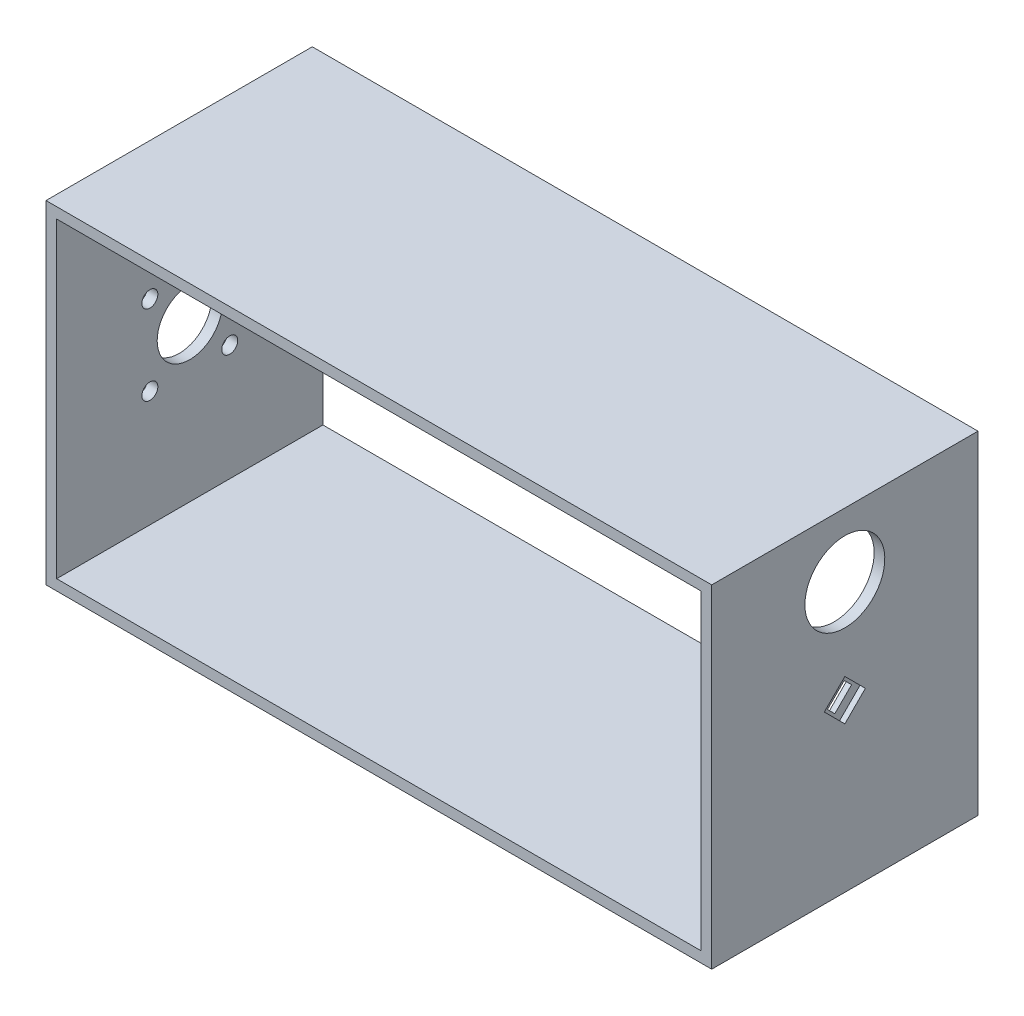
from build123d import *

# Parameters (mm, degrees)
SKIZZE1_W                       = 250
SKIZZE1_H                       = 125
SKIZZE1_W_2                     = 242
SKIZZE1_H_2                     = 117
AUFSATZ_LINEAR_AUSTRAGEN1_DEPTH = 100
SKIZZE2_R                       = 12.25
SCHNITT_LINEAR_AUSTRAGEN1_DEPTH = 10
SKIZZE3_R                       = 15
SCHNITT_LINEAR_AUSTRAGEN2_DEPTH = 10
SKIZZE4_R                       = 3
SCHNITT_LINEAR_AUSTRAGEN3_DEPTH = 10
SCHNITT_LINEAR_AUSTRAGEN6_DEPTH = 2
SCHNITT_LINEAR_AUSTRAGEN8_DEPTH = 32


with BuildPart() as part:
    # Skizze1 → Aufsatz-Linear austragen1 (new body)
    with BuildSketch(Plane.XY):
        with Locations((125, 62.5)):
            Rectangle(SKIZZE1_W, SKIZZE1_H)
        with Locations((125, 62.5)):
            Rectangle(SKIZZE1_W_2, SKIZZE1_H_2, mode=Mode.SUBTRACT)
    extrude(amount=AUFSATZ_LINEAR_AUSTRAGEN1_DEPTH)

    # Skizze2 → Schnitt-Linear austragen1 (cut)
    with BuildSketch(Plane.ZY):
        with Locations((50, 62.5)):
            Circle(SKIZZE2_R)
    extrude(amount=-SCHNITT_LINEAR_AUSTRAGEN1_DEPTH, mode=Mode.SUBTRACT)

    # Skizze3 → Schnitt-Linear austragen2 (cut)
    with BuildSketch(Plane.ZY.offset(-246)):
        with Locations((50, 101)):
            Circle(SKIZZE3_R)
    extrude(amount=-SCHNITT_LINEAR_AUSTRAGEN2_DEPTH, mode=Mode.SUBTRACT)

    # Skizze4 → Schnitt-Linear austragen3 (cut)
    with BuildSketch(Plane.ZY):
        with Locations((35, 77.5)):
            Circle(SKIZZE4_R)
        with Locations((65, 77.5)):
            Circle(SKIZZE4_R)
        with Locations((65, 47.5)):
            Circle(SKIZZE4_R)
        with Locations((35, 47.5)):
            Circle(SKIZZE4_R)
    extrude(amount=-SCHNITT_LINEAR_AUSTRAGEN3_DEPTH, mode=Mode.SUBTRACT)

    # Skizze8 → Schnitt-Linear austragen6 (cut)
    with BuildSketch(Plane(origin=(250, 0, 0), x_dir=(0, 0, -1), z_dir=(1, 0, 0))):
        Polygon((-50, 70.207463915), (-57.707463915, 62.5), (-50, 54.792536085), (-42.292536085, 62.5), align=None)
    extrude(amount=-SCHNITT_LINEAR_AUSTRAGEN6_DEPTH, mode=Mode.SUBTRACT)

    # Skizze10 → Schnitt-Linear austragen8 (cut)
    with BuildSketch(Plane(origin=(248, 0, 0), x_dir=(0, 0, -1), z_dir=(1, 0, 0))):
        Polygon((-48.228697513, 67.021947866), (-54.521947866, 60.728697513), (-51.771302487, 57.978052134), (-45.478052134, 64.271302487), align=None)
    extrude(amount=-SCHNITT_LINEAR_AUSTRAGEN8_DEPTH, mode=Mode.SUBTRACT)


solid = part.part
